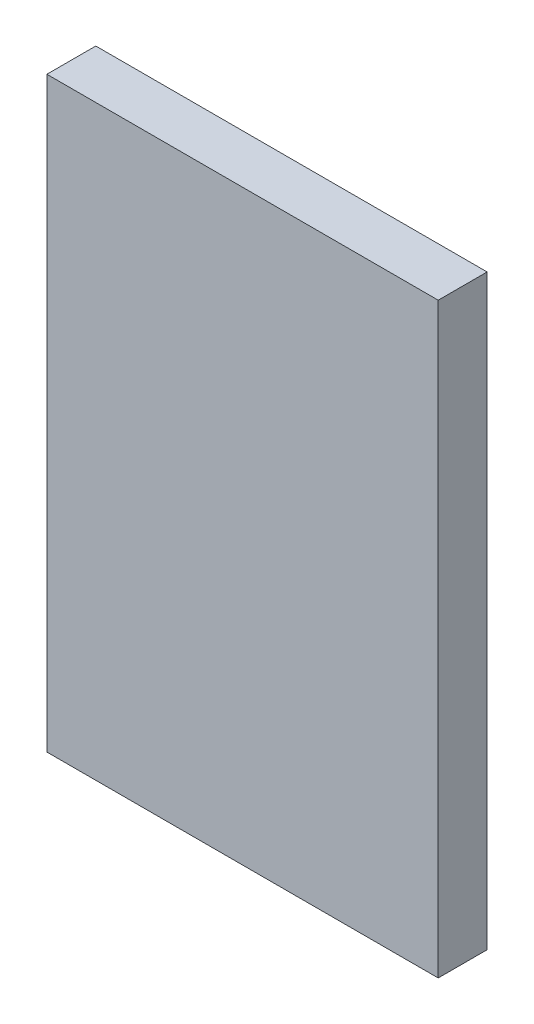
from build123d import *

# Parameters (mm, degrees)
SKETCH1_W           = 40
SKETCH1_H           = 60
BOSS_EXTRUDE1_DEPTH = 5
BOSS_EXTRUDE2_DEPTH = 6.35


with BuildPart() as part:
    # Sketch1 → Boss-Extrude1 (new body)
    with BuildSketch(Plane.XY):
        with Locations((0.386207951, -13.786739239)):
            Rectangle(SKETCH1_W, SKETCH1_H)
    extrude(amount=BOSS_EXTRUDE1_DEPTH)

    # Sketch4 → Boss-Extrude2 (add)
    with BuildSketch(Plane(origin=(0, 0, 0), x_dir=(-1, 0, 0), z_dir=(0, 0, -1))):
        with BuildLine():
            Line((12.899201513, -3.558164099), (12.899201513, -24.015314378))
            ThreePointArc((12.899201513, -24.015314378), (-0.386207951, -37.300723842), (-13.671617414, -24.015314378))
            Line((-13.671617414, -24.015314378), (-13.671617414, -3.558164099))
            ThreePointArc((-13.671617414, -3.558164099), (-0.386207951, 9.727245365), (12.899201513, -3.558164099))
        make_face()
        with BuildLine():
            Line((10.399201513, -3.558164099), (10.399201513, -24.015314378))
            ThreePointArc((10.399201513, -24.015314378), (-0.386207951, -34.800723842), (-11.171617414, -24.015314378))
            Line((-11.171617414, -24.015314378), (-11.171617414, -3.558164099))
            ThreePointArc((-11.171617414, -3.558164099), (-0.386207951, 7.227245365), (10.399201513, -3.558164099))
        make_face(mode=Mode.SUBTRACT)
    extrude(amount=BOSS_EXTRUDE2_DEPTH)


solid = part.part
